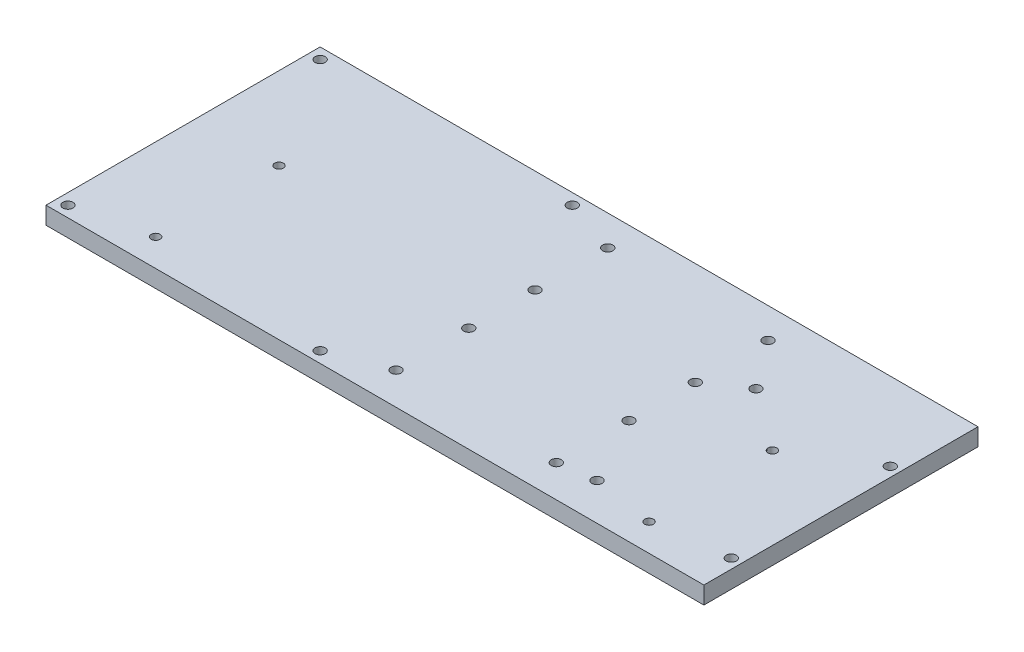
from build123d import *

# Parameters (mm, degrees)
SKETCH1_W                       = 240
SKETCH1_H                       = 100
BOSS_EXTRUDE1_DEPTH             = 6.35
F_3_0MM_CLEARANCE_DOWEL_HOLE2_D = 3.7
SKETCH6_R                       = 1.6
CUT_EXTRUDE1_DEPTH              = 131.154994142


with BuildPart() as part:
    # Sketch1 → Boss-Extrude1 (new body)
    with BuildSketch(Plane(origin=(0, 0, 0), x_dir=(1, 0, 0), z_dir=(0, 1, 0))):
        Rectangle(SKETCH1_W, SKETCH1_H)
    extrude(amount=BOSS_EXTRUDE1_DEPTH)

    # Ø3.0mm Clearance Dowel Hole2 (through all)
    with Locations(Plane(origin=(-50.304100292, 0, 69.560858654), x_dir=(-1, 0, 0), z_dir=(0, -1, 0))):
        with Locations((-46.279100292, 82.000858654), (-26.304100292, 115.560858654), (-46.279100292, 108.520858654), (-46.279100292, 57.820858654), (-46.279100292, 31.300858654), (-26.304100292, 23.560858654), (65.695899708, 23.560858654), (-104.729100292, 31.300858654), (-104.729100292, 57.820858654), (-104.729100292, 82.000858654), (-104.729100292, 108.520858654), (-166.804100292, 33.060858654), (-166.804100292, 91.060858654), (-117.804100292, 91.060858654), (-117.804100292, 33.060858654), (65.695899708, 115.560858654)):
            Hole(F_3_0MM_CLEARANCE_DOWEL_HOLE2_D / 2)

    # Sketch6 → Cut-Extrude1 (cut, through all)
    with BuildSketch(Plane(origin=(0, 6.35, 0), x_dir=(1, 0, 0), z_dir=(0, 1, 0))):
        with Locations((-90, 5)):
            Circle(SKETCH6_R)
        with Locations((-90, -40)):
            Circle(SKETCH6_R)
        with Locations((90, 5)):
            Circle(SKETCH6_R)
        with Locations((90, -40)):
            Circle(SKETCH6_R)
    extrude(amount=-CUT_EXTRUDE1_DEPTH, mode=Mode.SUBTRACT)


solid = part.part
